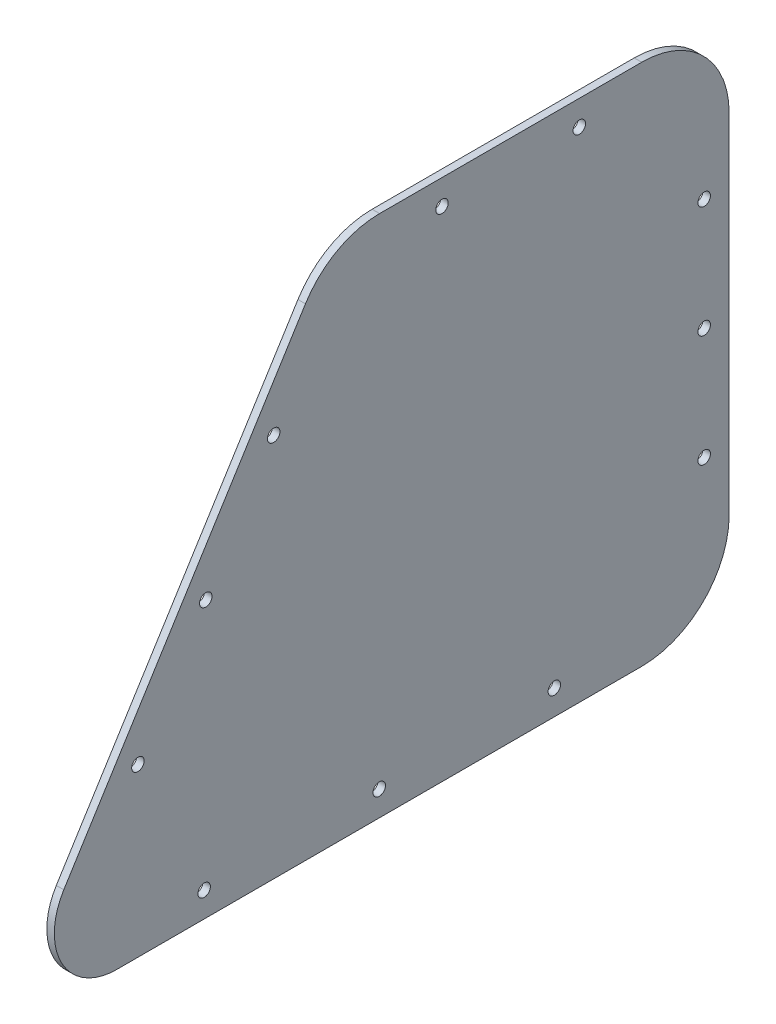
from build123d import *

# Parameters (mm, degrees)
BOSS_EXTRUDE1_DEPTH = 3
CUT_EXTRUDE1_REACH  = 241.724
SKETCH2_R           = 2.5


with BuildPart() as part:
    # Sketch1 → Boss-Extrude1 (new body)
    with BuildSketch(Plane(origin=(0, 0, 0), x_dir=(0, 0, -1), z_dir=(1, 0, 0))):
        with BuildLine():
            Line((-105.101332547, -15), (105.101332547, -15))
            ThreePointArc((105.101332547, -15), (129.850069889, -4.748737342), (140.101332547, 20))
            Line((140.101332547, 20), (140.101332547, 159.5))
            ThreePointArc((140.101332547, 159.5), (129.850069889, 184.248737342), (105.101332547, 194.5))
            Line((105.101332547, 194.5), (0.128643868, 194.5))
            ThreePointArc((0.128643868, 194.5), (-16.838254766, 190.112486844), (-29.551296772, 178.0499629))
            Line((-29.551296772, 178.0499629), (-126.301290147, 23.2499735))
            ThreePointArc((-126.301290147, 23.2499735), (-126.967394578, -2.11921331), (-105.101332547, -15))
        make_face()
    extrude(amount=BOSS_EXTRUDE1_DEPTH)

    # Sketch2 → Cut-Extrude1 (cut, up to next)
    with BuildSketch(Plane(origin=(3, 0, 0), x_dir=(0, 0, -1), z_dir=(1, 0, 0)), mode=Mode.PRIVATE) as cut_extrude1_sk1:
        with Locations((80.101332547, 184.5)):
            Circle(SKETCH2_R)
    cut_extrude1_tool1 = extrude(cut_extrude1_sk1.sketch, amount=-CUT_EXTRUDE1_REACH, mode=Mode.PRIVATE) & part.part
    # Sketch2 → Cut-Extrude1 (cut, up to next)
    with BuildSketch(Plane(origin=(3, 0, 0), x_dir=(0, 0, -1), z_dir=(1, 0, 0)), mode=Mode.PRIVATE) as cut_extrude1_sk2:
        with Locations((25.128643868, 184.5)):
            Circle(SKETCH2_R)
    cut_extrude1_tool2 = extrude(cut_extrude1_sk2.sketch, amount=-CUT_EXTRUDE1_REACH, mode=Mode.PRIVATE) & part.part
    # Sketch2 → Cut-Extrude1 (cut, up to next)
    with BuildSketch(Plane(origin=(3, 0, 0), x_dir=(0, 0, -1), z_dir=(1, 0, 0)), mode=Mode.PRIVATE) as cut_extrude1_sk3:
        with Locations((130.101332547, 134.5)):
            Circle(SKETCH2_R)
    cut_extrude1_tool3 = extrude(cut_extrude1_sk3.sketch, amount=-CUT_EXTRUDE1_REACH, mode=Mode.PRIVATE) & part.part
    # Sketch2 → Cut-Extrude1 (cut, up to next)
    with BuildSketch(Plane(origin=(3, 0, 0), x_dir=(0, 0, -1), z_dir=(1, 0, 0)), mode=Mode.PRIVATE) as cut_extrude1_sk4:
        with Locations((130.101332547, 89.75)):
            Circle(SKETCH2_R)
    cut_extrude1_tool4 = extrude(cut_extrude1_sk4.sketch, amount=-CUT_EXTRUDE1_REACH, mode=Mode.PRIVATE) & part.part
    # Sketch2 → Cut-Extrude1 (cut, up to next)
    with BuildSketch(Plane(origin=(3, 0, 0), x_dir=(0, 0, -1), z_dir=(1, 0, 0)), mode=Mode.PRIVATE) as cut_extrude1_sk5:
        with Locations((130.101332547, 45)):
            Circle(SKETCH2_R)
    cut_extrude1_tool5 = extrude(cut_extrude1_sk5.sketch, amount=-CUT_EXTRUDE1_REACH, mode=Mode.PRIVATE) & part.part
    # Sketch2 → Cut-Extrude1 (cut, up to next)
    with BuildSketch(Plane(origin=(3, 0, 0), x_dir=(0, 0, -1), z_dir=(1, 0, 0)), mode=Mode.PRIVATE) as cut_extrude1_sk6:
        with Locations((70.101332547, -5)):
            Circle(SKETCH2_R)
    cut_extrude1_tool6 = extrude(cut_extrude1_sk6.sketch, amount=-CUT_EXTRUDE1_REACH, mode=Mode.PRIVATE) & part.part
    # Sketch2 → Cut-Extrude1 (cut, up to next)
    with BuildSketch(Plane(origin=(3, 0, 0), x_dir=(0, 0, -1), z_dir=(1, 0, 0)), mode=Mode.PRIVATE) as cut_extrude1_sk7:
        with Locations((0, -5)):
            Circle(SKETCH2_R)
    cut_extrude1_tool7 = extrude(cut_extrude1_sk7.sketch, amount=-CUT_EXTRUDE1_REACH, mode=Mode.PRIVATE) & part.part
    # Sketch2 → Cut-Extrude1 (cut, up to next)
    with BuildSketch(Plane(origin=(3, 0, 0), x_dir=(0, 0, -1), z_dir=(1, 0, 0)), mode=Mode.PRIVATE) as cut_extrude1_sk8:
        with Locations((-70.101332547, -5)):
            Circle(SKETCH2_R)
    cut_extrude1_tool8 = extrude(cut_extrude1_sk8.sketch, amount=-CUT_EXTRUDE1_REACH, mode=Mode.PRIVATE) & part.part
    # Sketch2 → Cut-Extrude1 (cut, up to next)
    with BuildSketch(Plane(origin=(3, 0, 0), x_dir=(0, 0, -1), z_dir=(1, 0, 0)), mode=Mode.PRIVATE) as cut_extrude1_sk9:
        with Locations((-96.621349507, 51.86991626)):
            Circle(SKETCH2_R)
    cut_extrude1_tool9 = extrude(cut_extrude1_sk9.sketch, amount=-CUT_EXTRUDE1_REACH, mode=Mode.PRIVATE) & part.part
    # Sketch2 → Cut-Extrude1 (cut, up to next)
    with BuildSketch(Plane(origin=(3, 0, 0), x_dir=(0, 0, -1), z_dir=(1, 0, 0)), mode=Mode.PRIVATE) as cut_extrude1_sk10:
        with Locations((-69.44631042, 95.3499788)):
            Circle(SKETCH2_R)
    cut_extrude1_tool10 = extrude(cut_extrude1_sk10.sketch, amount=-CUT_EXTRUDE1_REACH, mode=Mode.PRIVATE) & part.part
    # Sketch2 → Cut-Extrude1 (cut, up to next)
    with BuildSketch(Plane(origin=(3, 0, 0), x_dir=(0, 0, -1), z_dir=(1, 0, 0)), mode=Mode.PRIVATE) as cut_extrude1_sk11:
        with Locations((-42.271271332, 138.83004134)):
            Circle(SKETCH2_R)
    cut_extrude1_tool11 = extrude(cut_extrude1_sk11.sketch, amount=-CUT_EXTRUDE1_REACH, mode=Mode.PRIVATE) & part.part
    add(cut_extrude1_tool1.solids().sort_by_distance((3, 184.5, -80.101333))[0], mode=Mode.SUBTRACT)
    add(cut_extrude1_tool2.solids().sort_by_distance((3, 184.5, -25.128644))[0], mode=Mode.SUBTRACT)
    add(cut_extrude1_tool3.solids().sort_by_distance((3, 134.5, -130.101333))[0], mode=Mode.SUBTRACT)
    add(cut_extrude1_tool4.solids().sort_by_distance((3, 89.75, -130.101333))[0], mode=Mode.SUBTRACT)
    add(cut_extrude1_tool5.solids().sort_by_distance((3, 45, -130.101333))[0], mode=Mode.SUBTRACT)
    add(cut_extrude1_tool6.solids().sort_by_distance((3, -5, -70.101333))[0], mode=Mode.SUBTRACT)
    add(cut_extrude1_tool7.solids().sort_by_distance((3, -5, 0))[0], mode=Mode.SUBTRACT)
    add(cut_extrude1_tool8.solids().sort_by_distance((3, -5, 70.101333))[0], mode=Mode.SUBTRACT)
    add(cut_extrude1_tool9.solids().sort_by_distance((3, 51.869916, 96.62135))[0], mode=Mode.SUBTRACT)
    add(cut_extrude1_tool10.solids().sort_by_distance((3, 95.349979, 69.44631))[0], mode=Mode.SUBTRACT)
    add(cut_extrude1_tool11.solids().sort_by_distance((3, 138.830041, 42.271271))[0], mode=Mode.SUBTRACT)


solid = part.part
